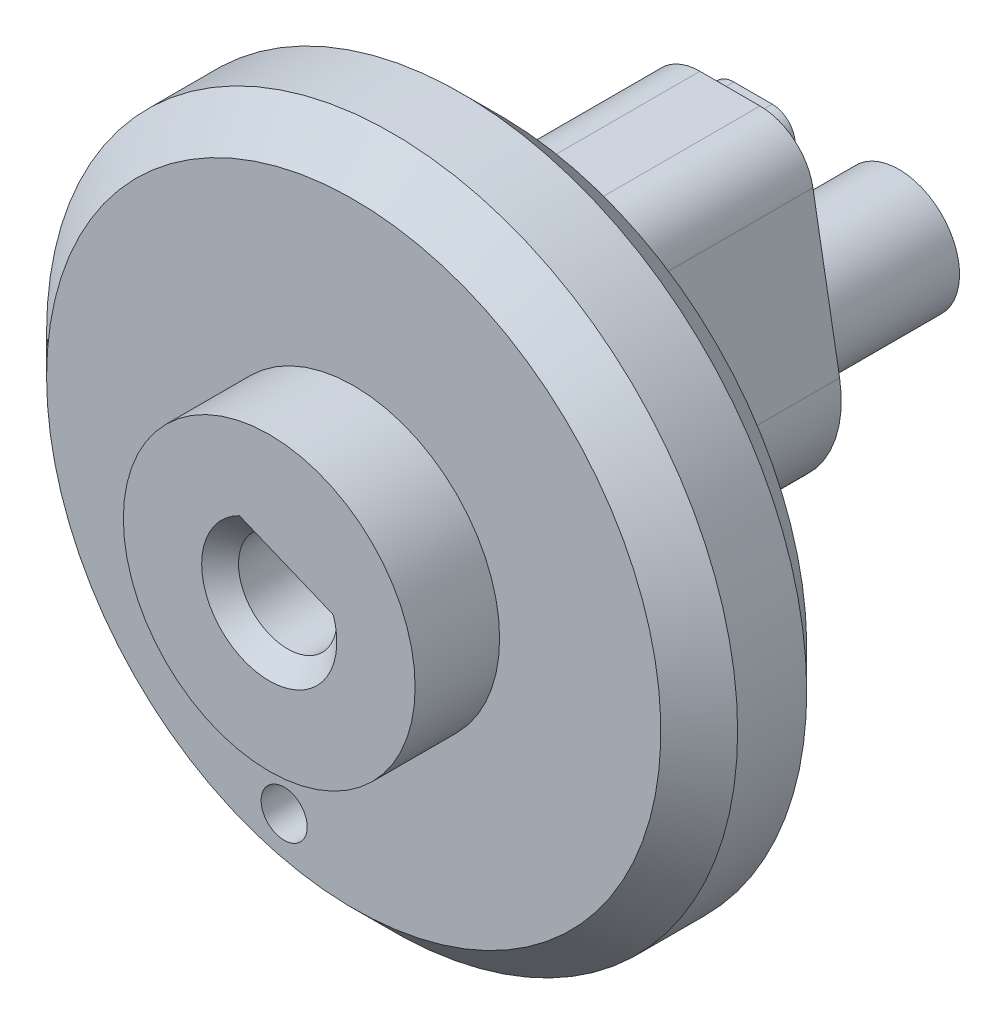
from build123d import *
from build123d.topology import SkipClean

# Parameters (mm, degrees)
EXTRUDE1_DEPTH               = 3.81
SKETCH8_R                    = 2.413
EXTRUDE8_DEPTH               = 3.81
SKETCH6_R                    = 5.715
EXTRUDE6_DEPTH               = 2.413
SKETCH4_R                    = 0.254
EXTRUDE4_DEPTH               = 6.731
SKETCH5_R                    = 1.0033
EXTRUDE5_DEPTH               = 2.794
FILLET2_R                    = 0.889
CHAMFER1_SIZE                = 0.635
SKETCH7_R                    = 0.381
EXTRUDE7_DEPTH               = 13.109035428
CHAMFER3_SIZE                = 0.635
EXTRUDE9_DEPTH               = 0.381
EXTRUDE10_DEPTH              = 1.397
EXTRUDE11_DEPTH              = 6.731
CIRPATTERN1_COUNT            = 8
EXTRUDE12_DEPTH              = 6.731
CHAMFER4_SIZE                = 0.381
CHAMFER4_SIZE2               = 0.659911358
EXTRUDE13_DEPTH              = 0.6604
CUT_REVOLVE1_ANGLE           = 130
CUT_REVOLVE1_OTHER_WAY_ANGLE = 90
BOSS_EXTRUDE1_DEPTH          = 6.071088642
CUT_EXTRUDE1_DEPTH           = 0.838688642
CHAMFER5_SIZE                = 0.1016
CHAMFER6_SIZE                = 0.3048


with BuildPart() as part:
    # Sketch1 → Extrude1 (new body)
    with BuildSketch(Plane.XY):
        with BuildLine():
            Line((-1.242889362, 3.556), (-1.813523477, 0.319773119))
            ThreePointArc((-1.813523477, 0.319773119), (0, -1.8415), (1.813523477, 0.319773119))
            Line((1.813523477, 0.319773119), (1.242889362, 3.556))
            Line((1.242889362, 3.556), (-1.242889362, 3.556))
        make_face()
    extrude(amount=EXTRUDE1_DEPTH)

    # Sketch8 → Extrude8 (add)
    with BuildSketch(Plane.XY.offset(3.81)):
        with Locations(Location((0, 0, 0), (0, 0, 129.743387424))):
            Circle(SKETCH8_R)
    extrude(amount=EXTRUDE8_DEPTH)

    # Sketch6 → Extrude6 (add)
    with BuildSketch(Plane.XY.offset(3.81)):
        Circle(SKETCH6_R)
    extrude(amount=EXTRUDE6_DEPTH)

    # Sketch4 → Extrude4 (cut)
    with BuildSketch(Plane.XY.offset(7.62)):
        Circle(SKETCH4_R)
    extrude(amount=-EXTRUDE4_DEPTH, mode=Mode.SUBTRACT)

    # Sketch5 → Extrude5 (add)
    with BuildSketch(Plane(origin=(0, 0, 0), x_dir=(-1, 0, 0), z_dir=(0, 0, -1))):
        with Locations(Location((0, 0, 0), (0, 0, 180))):
            Circle(SKETCH5_R)
    extrude(amount=EXTRUDE5_DEPTH)

    # Fillet2
    fillet2_edges = [part.edges().sort_by_distance(p)[0] for p in [
        (1.242889362, 3.556, 1.905),
        (-1.242889362, 3.556, 1.905),
    ]]
    fillet(fillet2_edges, radius=FILLET2_R)

    # Chamfer1
    chamfer1_edges = [part.edges().sort_by_distance(p)[0] for p in [
        (-5.715, 0, 3.81),
    ]]
    chamfer(chamfer1_edges, length=CHAMFER1_SIZE)

    # Sketch7 → Extrude7 (cut, through all)
    with BuildSketch(Plane.XY.offset(6.223)):
        with Locations((-1.150450655, -4.293540298)):
            Circle(SKETCH7_R)
    extrude(amount=-EXTRUDE7_DEPTH, mode=Mode.SUBTRACT)

    # Chamfer3
    chamfer3_edges = [part.edges().sort_by_distance(p)[0] for p in [
        (-5.715, 0, 6.223),
    ]]
    chamfer(chamfer3_edges, length=CHAMFER3_SIZE)

    # Sketch9 → Extrude9 (add)
    with BuildSketch(Plane(origin=(0, 0, 0), x_dir=(-1, 0, 0), z_dir=(0, 0, -1))):
        with BuildLine():
            Line((-0.3175, 3.302), (0.3175, 3.302))
            ThreePointArc((0.3175, 3.302), (0.586907684, 3.190407684), (0.6985, 2.921))
            Line((0.6985, 2.921), (0.6985, 0))
            Line((0.6985, 0), (-0.6985, 0))
            Line((-0.6985, 0), (-0.6985, 2.921))
            ThreePointArc((-0.6985, 2.921), (-0.586907684, 3.190407684), (-0.3175, 3.302))
        make_face()
    extrude(amount=EXTRUDE9_DEPTH)

    # Sketch11 → Extrude10 (cut)
    with BuildSketch(Plane(origin=(0, 0, 3.81), x_dir=(-1, 0, 0), z_dir=(0, 0, -1))):
        with BuildLine():
            Line((1.868871145, -3.575119808), (3.096912551, -4.803161214))
            Line((3.096912551, -4.803161214), (3.096912551, -5.713418243))
            Line((3.096912551, -5.713418243), (0.134450655, -5.713418243))
            Line((0.134450655, -5.713418243), (0.134450655, -4.293540298))
            ThreePointArc((0.134450655, -4.293540298), (0.761644288, -3.354878693), (1.868871145, -3.575119808))
        make_face()
    extrude(amount=-EXTRUDE10_DEPTH, mode=Mode.SUBTRACT)

    # Sketch17 → Extrude11 (cut)
    with BuildSketch(Plane.XY.offset(7.62)):
        with BuildLine():
            Line((0, 0), (0, 0.8128))
            ThreePointArc((0, 0.8128), (0.077181384, 0.80912723), (0.153665255, 0.798142111))
            ThreePointArc((0.153665255, 0.798142111), (0.281884616, 0.680529664), (0.455713955, 0.673029443))
            ThreePointArc((0.455713955, 0.673029443), (0.517563871, 0.626714831), (0.574736392, 0.574736392))
            Line((0.574736392, 0.574736392), (0, 0))
        make_face()
    extrude11 = extrude(amount=-EXTRUDE11_DEPTH, mode=Mode.SUBTRACT)

    # CirPattern1: Extrude11 ×8 about axis
    cirpattern1_axis = Axis((0, 0, 0), (0, 0, 1))
    for i in range(1, CIRPATTERN1_COUNT):
        add(extrude11.rotate(cirpattern1_axis, i * 360 / CIRPATTERN1_COUNT), mode=Mode.SUBTRACT)

    # Sketch18 → Extrude12 (add)
    with BuildSketch(Plane.XY.offset(7.62)):
        Polygon((-0.539167209, 0.608229037), (0.811331666, 0.048834087), (0.986294531, 0.471231809), (-0.364204343, 1.030626759), align=None)
    extrude(amount=-EXTRUDE12_DEPTH)

    # Chamfer4
    chamfer4_edges = [part.edges().sort_by_distance(p)[0] for p in [
        (0.136082229, 0.328531562, 7.62),
    ]]
    chamfer4_side = [part.faces().sort_by_distance(p)[0] for p in [
        (1.499116567, -1.802914954, 7.62),
    ]]
    chamfer(chamfer4_edges, length=CHAMFER4_SIZE, length2=CHAMFER4_SIZE2, reference=chamfer4_side[0])

    # Sketch19 → Extrude13 (cut)
    with SkipClean():  # the faces are left unmerged after this step: merging them gives an invalid solid
        with BuildSketch(Plane.XY.offset(7.62)):
            with BuildLine():
                Line((0.811331666, 0.048834087), (-0.539167209, 0.608229037))
                ThreePointArc((-0.539167209, 0.608229037), (-0.311045094, -0.750929284), (0.811331666, 0.048834087))
            make_face()
        extrude(amount=-EXTRUDE13_DEPTH, mode=Mode.SUBTRACT)

    # Sketch20 → Cut-Revolve1 (revolve, cut)
    with SkipClean():  # the faces are left unmerged after this step: merging them gives an invalid solid
        with BuildSketch(Plane(origin=(0, 0, 0), x_dir=(0, 0, -1), z_dir=(1, 0, 0))):
            Polygon((-6.9596, -0.8128), (-6.9596, 0), (-6.1468, 0), align=None)
        revolve(axis=Axis((0, 0, 7.389643883), (0, 0, -1)), revolution_arc=CUT_REVOLVE1_ANGLE, mode=Mode.SUBTRACT)

    # Sketch20 → Cut-Revolve1 other way (revolve, cut)
    with SkipClean():  # the faces are left unmerged after this step: merging them gives an invalid solid
        with BuildSketch(Plane(origin=(0, 0, 0), x_dir=(0, 0, -1), z_dir=(1, 0, 0))):
            Polygon((-6.9596, -0.8128), (-6.9596, 0), (-6.1468, 0), align=None)
        revolve(axis=Axis((0, 0, 7.389643883), (0, 0, 1)), revolution_arc=CUT_REVOLVE1_OTHER_WAY_ANGLE, mode=Mode.SUBTRACT)

    # Sketch21 → Boss-Extrude1 (add)
    with SkipClean():  # the faces are left unmerged after this step: merging them gives an invalid solid
        with BuildSketch(Plane.XY.offset(6.960088642)):
            with BuildLine():
                Line((-0.459893976, 0.575392988), (-0.539167209, 0.608229037))
                ThreePointArc((-0.539167209, 0.608229037), (-0.311045094, -0.750929284), (0.811331666, 0.048834087))
                Line((0.811331666, 0.048834087), (0.732058433, 0.081670135))
                ThreePointArc((0.732058433, 0.081670135), (-0.281884616, -0.680529664), (-0.459893976, 0.575392988))
            make_face()
        extrude(amount=-BOSS_EXTRUDE1_DEPTH)

    # Sketch22 → Cut-Extrude1 (cut)
    with SkipClean():  # the faces are left unmerged after this step: merging them gives an invalid solid
        with BuildSketch(Plane.XY.offset(6.960088642)):
            with BuildLine():
                Line((-0.459893976, 0.575392988), (-0.539167209, 0.608229037))
                ThreePointArc((-0.539167209, 0.608229037), (-0.311045094, -0.750929284), (0.811331666, 0.048834087))
                Line((0.811331666, 0.048834087), (0.732058433, 0.081670135))
                ThreePointArc((0.732058433, 0.081670135), (-0.281884616, -0.680529664), (-0.459893976, 0.575392988))
            make_face()
        extrude(amount=-CUT_EXTRUDE1_DEPTH, mode=Mode.SUBTRACT)

    # Chamfer5
    # the kernel refuses this chamfer: 0.1016 mm, written as the material it takes off along each edge
    with BuildSketch(Plane(origin=(0, 0, 6.1214), x_dir=(-0.3826834323650876, -0.9238795325112875, 0), z_dir=(0.9238795325112875, -0.3826834323650876, 0))) as chamfer5_piece_1_section:
        Polygon((0.7366 + CHAMFER5_SIZE, 0), (0.7366, CHAMFER5_SIZE), (0.7366, 0), align=None)
    chamfer5_piece_1 = revolve(axis=Axis((0, 0, 6.1214), (0, 0, -1)), revolution_arc=45, mode=Mode.PRIVATE)
    chamfer5_piece_1 = chamfer5_piece_1 & Plane(origin=(0, 0, 6.085965336), x_dir=(-0.6633454831704748, 0.74831328329606, 0), z_dir=(0, 0, 1)) * Cylinder(0.8128, 4, mode=Mode.PRIVATE)
    add(chamfer5_piece_1, mode=Mode.SUBTRACT)
    with BuildSketch(Plane(origin=(0, 0, 6.1214), x_dir=(0.3826834323650712, -0.9238795325112945, 0), z_dir=(0.9238795325112945, 0.3826834323650712, 0))) as chamfer5_piece_2_section:
        Polygon((0.7366 + CHAMFER5_SIZE, 0), (0.7366, CHAMFER5_SIZE), (0.7366, 0), align=None)
    chamfer5_piece_2 = revolve(axis=Axis((0, 0, 6.1214), (0, 0, -1)), revolution_arc=45, mode=Mode.PRIVATE)
    chamfer5_piece_2 = chamfer5_piece_2 & Plane(origin=(0, 0, 6.085965336), x_dir=(-0.6633454831704748, 0.74831328329606, 0), z_dir=(0, 0, 1)) * Cylinder(0.8128, 4, mode=Mode.PRIVATE)
    add(chamfer5_piece_2, mode=Mode.SUBTRACT)
    with BuildSketch(Plane(origin=(0, 0, 6.1214), x_dir=(-0.9238795325112938, -0.3826834323650728, 0), z_dir=(0.3826834323650728, -0.9238795325112938, 0))) as chamfer5_piece_3_section:
        Polygon((0.7366 + CHAMFER5_SIZE, 0), (0.7366, CHAMFER5_SIZE), (0.7366, 0), align=None)
    chamfer5_piece_3 = revolve(axis=Axis((0, 0, 6.1214), (0, 0, -1)), revolution_arc=45, mode=Mode.PRIVATE)
    chamfer5_piece_3 = chamfer5_piece_3 & Plane(origin=(0, 0, 6.085965336), x_dir=(-0.6633454831704748, 0.74831328329606, 0), z_dir=(0, 0, 1)) * Cylinder(0.8128, 4, mode=Mode.PRIVATE)
    add(chamfer5_piece_3, mode=Mode.SUBTRACT)
    with BuildSketch(Plane(origin=(0, 0, 6.1214), x_dir=(-0.9238795325112764, 0.3826834323651145, 0), z_dir=(-0.3826834323651145, -0.9238795325112764, 0))) as chamfer5_piece_4_section:
        Polygon((0.7366 + CHAMFER5_SIZE, 0), (0.7366, CHAMFER5_SIZE), (0.7366, 0), align=None)
    chamfer5_piece_4 = revolve(axis=Axis((0, 0, 6.1214), (0, 0, -1)), revolution_arc=49.190233443, mode=Mode.PRIVATE)
    chamfer5_piece_4 = chamfer5_piece_4 & Plane(origin=(0, 0, 6.085613455), x_dir=(-0.6633454831704748, 0.74831328329606, 0), z_dir=(0, 0, 1)) * Cylinder(0.8128, 4, mode=Mode.PRIVATE)
    chamfer5_piece_4 = split(chamfer5_piece_4, bisect_by=Plane(origin=(-0.544175649, 0.610303601, 6.085613455), z_dir=(-0.38268343236508656, -0.9238795325112882, 0)), keep=Keep.TOP, mode=Mode.PRIVATE)
    add(chamfer5_piece_4, mode=Mode.SUBTRACT)
    with BuildSketch(Plane(origin=(0, 0, 6.1214), x_dir=(0.9238795325112772, -0.3826834323651127, 0), z_dir=(0.3826834323651127, 0.9238795325112772, 0))) as chamfer5_piece_5_section:
        Polygon((0.7366 + CHAMFER5_SIZE, 0), (0.7366, CHAMFER5_SIZE), (0.7366, 0), align=None)
    chamfer5_piece_5 = revolve(axis=Axis((0, 0, 6.1214), (0, 0, -1)), revolution_arc=45, mode=Mode.PRIVATE)
    chamfer5_piece_5 = chamfer5_piece_5 & Plane(origin=(0, 0, 6.085965336), x_dir=(-0.6633454831704748, 0.74831328329606, 0), z_dir=(0, 0, 1)) * Cylinder(0.8128, 4, mode=Mode.PRIVATE)
    add(chamfer5_piece_5, mode=Mode.SUBTRACT)
    with BuildSketch(Plane(origin=(0, 0, 6.1214), x_dir=(0.8934479656215565, 0.44916670928142266, 0), z_dir=(-0.44916670928142266, 0.8934479656215565, 0))) as chamfer5_piece_6_section:
        Polygon((0.7366 + CHAMFER5_SIZE, 0), (0.7366, CHAMFER5_SIZE), (0.7366, 0), align=None)
    chamfer5_piece_6 = revolve(axis=Axis((0, 0, 6.1214), (0, 0, -1)), revolution_arc=49.190233443, mode=Mode.PRIVATE)
    chamfer5_piece_6 = chamfer5_piece_6 & Plane(origin=(0, 0, 6.085613455), x_dir=(-0.6633454831704748, 0.74831328329606, 0), z_dir=(0, 0, 1)) * Cylinder(0.8128, 4, mode=Mode.PRIVATE)
    chamfer5_piece_6 = split(chamfer5_piece_6, bisect_by=Plane(origin=(0.816340106, 0.046759523, 6.085613455), z_dir=(-0.38268343236508556, -0.9238795325112885, 0)), keep=Keep.TOP, mode=Mode.PRIVATE)
    add(chamfer5_piece_6, mode=Mode.SUBTRACT)

    # Chamfer6
    chamfer6_edges = [part.edges().sort_by_distance(p)[0] for p in [
        (-0.311045094, -0.750929284, 7.62),
    ]]
    chamfer(chamfer6_edges, length=CHAMFER6_SIZE)


solid = part.part
